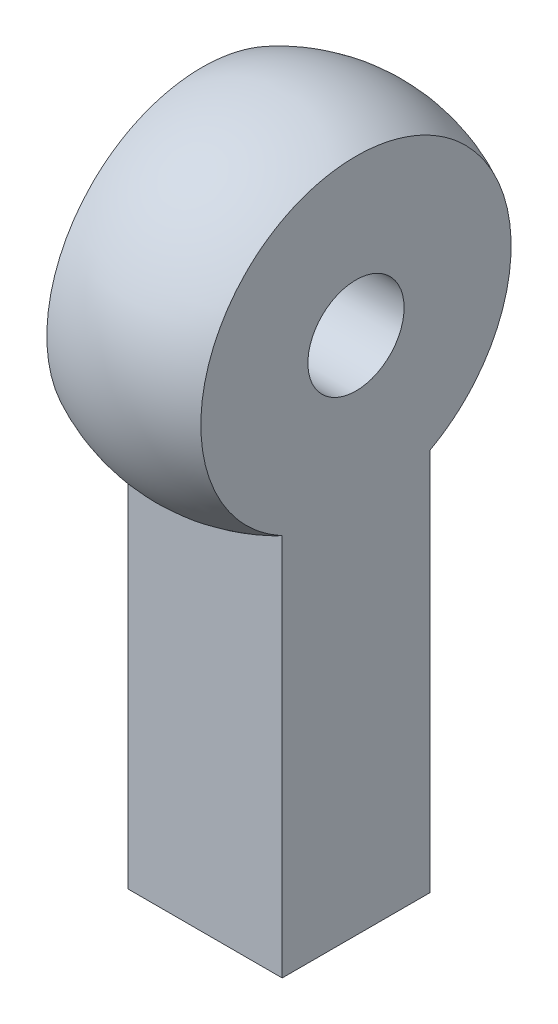
from build123d import *

# Parameters (mm, degrees)
CUT_EXTRUDE_START        = -9
CUT_EXTRUDE_1_OUTLINE_W  = 6
CUT_EXTRUDE_1_OUTLINE_H  = 20
CUT_EXTRUDE_1_DEPTH      = 18
CUT_EXTRUDE_2_DEPTH      = 19.193405399
CUT_EXTRUDE_2_DEPTH_BACK = 19.193405399
SKETCH_3_R               = 2.5
SKETCH_4_W               = 7.669123848
SKETCH_4_H               = 20.676781993
EXTRUDE_1_DEPTH          = 8
SKETCH_5_R               = 2
CUT_EXTRUDE_3_DEPTH      = 15


with BuildPart() as part:
    # 草图1 → 旋转1 (revolve)
    with BuildSketch(Plane(origin=(0, 0, 0), x_dir=(0, 0, -1), z_dir=(1, 0, 0))):
        with BuildLine():
            Line((0, 9), (0, -9))
            ThreePointArc((0, -9), (-9, 0), (0, 9))
        make_face()
    revolve(axis=Axis((0, 9, 0), (0, -1, 0)))

    # 切除-拉伸1: read off the stored shape, not the designer's step
    # 切除-拉伸1 outline → 切除-拉伸1 (cut)
    with BuildSketch(Plane.XY.offset(CUT_EXTRUDE_START)):
        with Locations((-7, 0)):
            Rectangle(CUT_EXTRUDE_1_OUTLINE_W, CUT_EXTRUDE_1_OUTLINE_H)
        with Locations((7, 0)):
            Rectangle(CUT_EXTRUDE_1_OUTLINE_W, CUT_EXTRUDE_1_OUTLINE_H)
    extrude(amount=CUT_EXTRUDE_1_DEPTH, mode=Mode.SUBTRACT)

    # 草图3 → 切除-拉伸2 (cut, two sides: drawn at the far end of the back side and taken through both)
    with BuildSketch(Plane(origin=(4, 0, 0), x_dir=(0, 0, -1), z_dir=(1, 0, 0)).offset(-CUT_EXTRUDE_2_DEPTH_BACK)):
        Circle(SKETCH_3_R)
    extrude(amount=CUT_EXTRUDE_2_DEPTH + CUT_EXTRUDE_2_DEPTH_BACK, mode=Mode.SUBTRACT)

    # 草图4 → 凸台-拉伸1 (add)
    with BuildSketch(Plane(origin=(4, 0, 0), x_dir=(0, 0, -1), z_dir=(1, 0, 0))):
        with Locations((0, -16.661609004)):
            Rectangle(SKETCH_4_W, SKETCH_4_H)
    extrude(amount=-EXTRUDE_1_DEPTH)

    # 草图5 → 切除-拉伸3 (cut)
    with BuildSketch(Plane.XZ.offset(27)):
        with Locations(Location((0, 0, 0), (0, 0, 270))):
            Circle(SKETCH_5_R)
    extrude(amount=-CUT_EXTRUDE_3_DEPTH, mode=Mode.SUBTRACT)


solid = part.part
